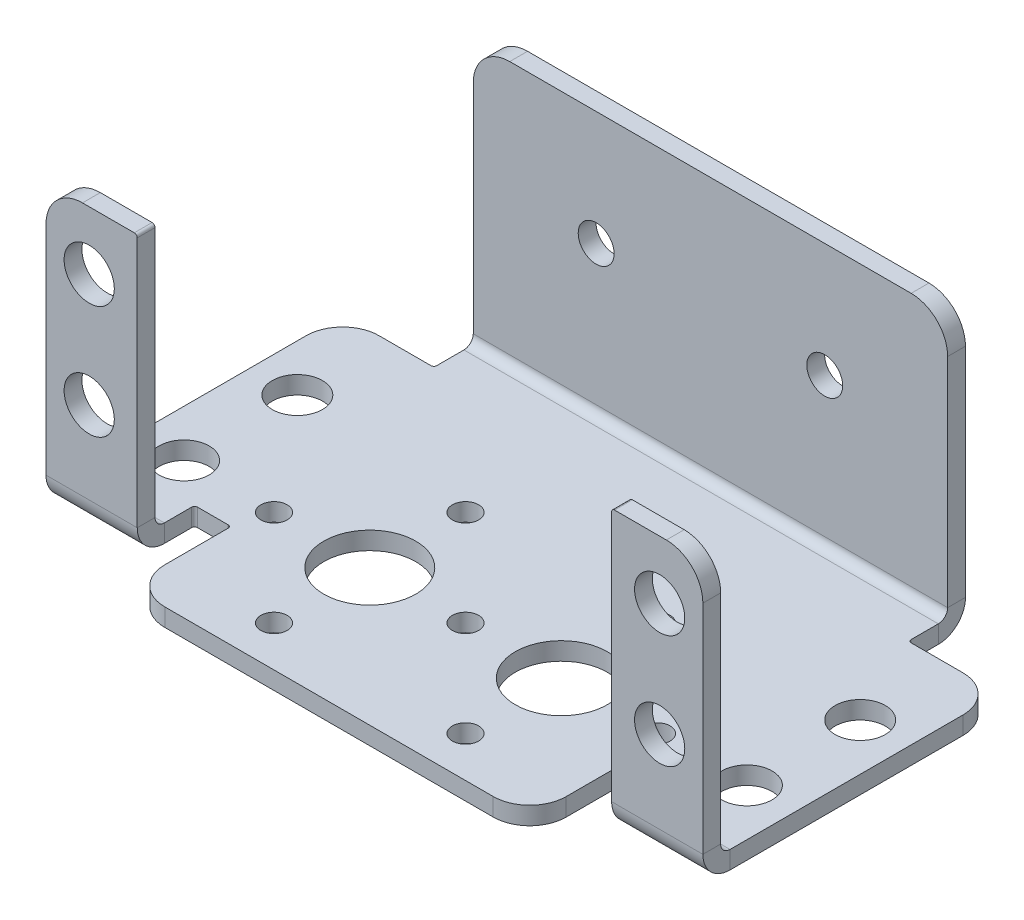
from build123d import *

# Parameters (mm, degrees)
BASE_FLANGE1_DEPTH             = 1.5494
EDGE_FLANGE1_STRIP_W           = 7.8232
EDGE_FLANGE1_STRIP_H           = 1.5494
EDGE_FLANGE1_STRIP_CUT_DEPTH   = 41.275
EDGE_FLANGE1_DEPTH             = 41.275
EDGE_FLANGE2_STRIP_W           = 7.8232
EDGE_FLANGE2_STRIP_H           = 1.5494
EDGE_FLANGE2_STRIP_CUT_DEPTH   = 7.9375
EDGE_FLANGE2_STRIP_2_W         = 7.8232
EDGE_FLANGE2_STRIP_2_H         = 1.5494
EDGE_FLANGE2_STRIP_CUT_2_DEPTH = 7.9375
EDGE_FLANGE2_DEPTH             = 7.9375
EDGE_FLANGE2_BEND_DEPTH        = 7.9375
SKETCH13_R                     = 1.143
SKETCH13_R_2                   = 4.0005
SKETCH13_R_3                   = 2.1844
EXTRUDE2_DEPTH                 = 1.5494
SKETCH14_R                     = 2.1844
EXTRUDE3_DEPTH                 = 1.5494
SKETCH15_R                     = 1.5621
EXTRUDE4_DEPTH                 = 1.5494
FILLET1_R                      = 3.175
FILLET2_R                      = 0.254


# Sheet-metal steps are written as plain solids
with BuildPart() as part:
    # Sketch1 → Base-Flange1 (new body)
    with BuildSketch(Plane(origin=(0, 0, 0), x_dir=(1, 0, 0), z_dir=(0, 1, 0))):
        Polygon((-17.4625, -11.8745), (17.4625, -11.8745), (17.4625, -2.9337), (20.6375, -2.9337), (20.6375, -6.3754), (28.575, -6.3754), (28.575, 17.8816), (20.6375, 17.8816), (20.6375, 21.3106), (-20.6375, 21.3106), (-20.6375, 17.8816), (-28.575, 17.8816), (-28.575, -6.3754), (-20.6375, -6.3754), (-20.6375, -2.9337), (-17.4625, -2.9337), align=None)
    extrude(amount=BASE_FLANGE1_DEPTH)

    # Edge-Flange1 strip (across the edge) → Edge-Flange1 strip cut (cut)
    with BuildSketch(Plane(origin=(20.6375, 1.5494, -21.3106), x_dir=(0, 0, 1), z_dir=(-1, 0, 0))):
        with Locations((-3.0988, -0.7747)):
            Rectangle(EDGE_FLANGE1_STRIP_W, EDGE_FLANGE1_STRIP_H)
    extrude(amount=EDGE_FLANGE1_STRIP_CUT_DEPTH, mode=Mode.SUBTRACT)

    # Edge-Flange1 section (across the edge) → Edge-Flange1 (add)
    with BuildSketch(Plane(origin=(20.6375, 1.5494, -21.3106), x_dir=(0, 0, 1), z_dir=(-1, 0, 0))):
        with BuildLine():
            Line((-1.5494, 0.8128), (-1.5494, 22.9108))
            Line((-1.5494, 22.9108), (0, 22.9108))
            Line((0, 22.9108), (0, 0.8128))
            ThreePointArc((0, 0.8128), (0.238063608, 0.238063608), (0.8128, 0))
            Line((0.8128, 0), (0.8128, -1.5494))
            ThreePointArc((0.8128, -1.5494), (-0.857527639, -0.857527639), (-1.5494, 0.8128))
        make_face()
    extrude(amount=EDGE_FLANGE1_DEPTH)

    # Edge-Flange2 strip (across the edge) → Edge-Flange2 strip cut (cut)
    with BuildSketch(Plane(origin=(-28.575, 1.5494, 6.3754), x_dir=(0, 0, -1), z_dir=(1, 0, 0))):
        with Locations((-3.0988, -0.7747)):
            Rectangle(EDGE_FLANGE2_STRIP_W, EDGE_FLANGE2_STRIP_H)
    extrude(amount=EDGE_FLANGE2_STRIP_CUT_DEPTH, mode=Mode.SUBTRACT)

    # Edge-Flange2 strip 2 (across the edge) → Edge-Flange2 strip cut 2 (cut)
    with BuildSketch(Plane(origin=(20.6375, 1.5494, 6.3754), x_dir=(0, 0, -1), z_dir=(1, 0, 0))):
        with Locations((-3.0988, -0.7747)):
            Rectangle(EDGE_FLANGE2_STRIP_2_W, EDGE_FLANGE2_STRIP_2_H)
    extrude(amount=EDGE_FLANGE2_STRIP_CUT_2_DEPTH, mode=Mode.SUBTRACT)

    # Edge-Flange2 section (across the edge) → Edge-Flange2 (add)
    with BuildSketch(Plane(origin=(-28.575, 1.5494, 6.3754), x_dir=(0, 0, -1), z_dir=(1, 0, 0))):
        with BuildLine():
            Line((-1.5494, 0.8128), (-1.5494, 22.9108))
            Line((-1.5494, 22.9108), (0, 22.9108))
            Line((0, 22.9108), (0, 0.8128))
            ThreePointArc((0, 0.8128), (0.238063608, 0.238063608), (0.8128, 0))
            Line((0.8128, 0), (0.8128, -1.5494))
            ThreePointArc((0.8128, -1.5494), (-0.857527639, -0.857527639), (-1.5494, 0.8128))
        make_face()
    extrude(amount=EDGE_FLANGE2_DEPTH)

    # Edge-Flange2 section 2 (across the edge) → Edge-Flange2 bend (add)
    with BuildSketch(Plane(origin=(20.6375, 1.5494, 6.3754), x_dir=(0, 0, -1), z_dir=(1, 0, 0))):
        with BuildLine():
            Line((-1.5494, 0.8128), (-1.5494, 22.9108))
            Line((-1.5494, 22.9108), (0, 22.9108))
            Line((0, 22.9108), (0, 0.8128))
            ThreePointArc((0, 0.8128), (0.238063608, 0.238063608), (0.8128, 0))
            Line((0.8128, 0), (0.8128, -1.5494))
            ThreePointArc((0.8128, -1.5494), (-0.857527639, -0.857527639), (-1.5494, 0.8128))
        make_face()
    extrude(amount=EDGE_FLANGE2_BEND_DEPTH)

    # Sketch13 → Extrude2 (cut)
    with BuildSketch(Plane(origin=(0, 1.5494, 0), x_dir=(1, 0, 0), z_dir=(0, 1, 0))):
        with Locations(Location((0, 0, 0), (0, 0, 270))):
            Circle(SKETCH13_R)
        with Locations(Location((8.3312, 8.3312, 0), (0, 0, 270))):
            Circle(SKETCH13_R)
        with Locations(Location((8.3312, -8.3312, 0), (0, 0, 270))):
            Circle(SKETCH13_R)
        with Locations(Location((16.6624, 0, 0), (0, 0, 270))):
            Circle(SKETCH13_R)
        with Locations(Location((-8.3312, 8.3312, 0), (0, 0, 270))):
            Circle(SKETCH13_R)
        with Locations(Location((-8.3312, -8.3312, 0), (0, 0, 270))):
            Circle(SKETCH13_R)
        with Locations(Location((-16.6624, 0, 0), (0, 0, 270))):
            Circle(SKETCH13_R)
        with Locations(Location((-8.3312, 0, 0), (0, 0, 270))):
            Circle(SKETCH13_R_2)
        with Locations(Location((8.3312, 0, 0), (0, 0, 270))):
            Circle(SKETCH13_R_2)
        with Locations(Location((-24.4856, 9.8552, 0), (0, 0, 270))):
            Circle(SKETCH13_R_3)
        with Locations(Location((-24.4856, 0, 0), (0, 0, 270))):
            Circle(SKETCH13_R_3)
        with Locations(Location((24.4856, 9.8552, 0), (0, 0, 270))):
            Circle(SKETCH13_R_3)
        with Locations(Location((24.4856, 0, 0), (0, 0, 270))):
            Circle(SKETCH13_R_3)
    extrude(amount=-EXTRUDE2_DEPTH, mode=Mode.SUBTRACT)

    # Sketch14 → Extrude3 (cut)
    with BuildSketch(Plane.XY.offset(7.9248)):
        with Locations((-24.8158, 19.3802)):
            Circle(SKETCH14_R)
        with Locations((-24.8158, 9.525)):
            Circle(SKETCH14_R)
        with Locations((24.8158, 19.3802)):
            Circle(SKETCH14_R)
        with Locations((24.8158, 9.525)):
            Circle(SKETCH14_R)
    extrude(amount=-EXTRUDE3_DEPTH, mode=Mode.SUBTRACT)

    # Sketch15 → Extrude4 (cut)
    with BuildSketch(Plane(origin=(0, 0, -22.86), x_dir=(-1, 0, 0), z_dir=(0, 0, -1))):
        with Locations(Location((-9.9441, 14.5161, 0), (0, 0, 90))):
            Circle(SKETCH15_R)
        with Locations(Location((9.9441, 14.5161, 0), (0, 0, 90))):
            Circle(SKETCH15_R)
    extrude(amount=-EXTRUDE4_DEPTH, mode=Mode.SUBTRACT)

    # Fillet1
    fillet1_edges = [part.edges().sort_by_distance(p)[0] for p in [
        (-28.575, 24.4602, 7.1501),
        (28.575, 24.4602, 7.1501),
        (-28.575, 0.7747, -17.8816),
        (28.575, 0.7747, -17.8816),
        (17.4625, 0.7747, 11.8745),
        (-17.4625, 0.7747, 11.8745),
        (20.6375, 24.4602, -22.0853),
        (-20.6375, 24.4602, -22.0853),
    ]]
    fillet(fillet1_edges, radius=FILLET1_R)

    # Fillet2
    fillet2_edges = [part.edges().sort_by_distance(p)[0] for p in [
        (-20.6375, 24.4602, 7.1501),
        (20.6375, 24.4602, 7.1501),
        (-17.4625, 0.7747, 2.9337),
        (-20.6375, 0.7747, 2.9337),
        (-20.6375, 0.7747, -17.8816),
        (20.6375, 0.7747, -17.8816),
        (20.6375, 0.7747, 2.9337),
        (17.4625, 0.7747, 2.9337),
    ]]
    fillet(fillet2_edges, radius=FILLET2_R)


solid = part.part
